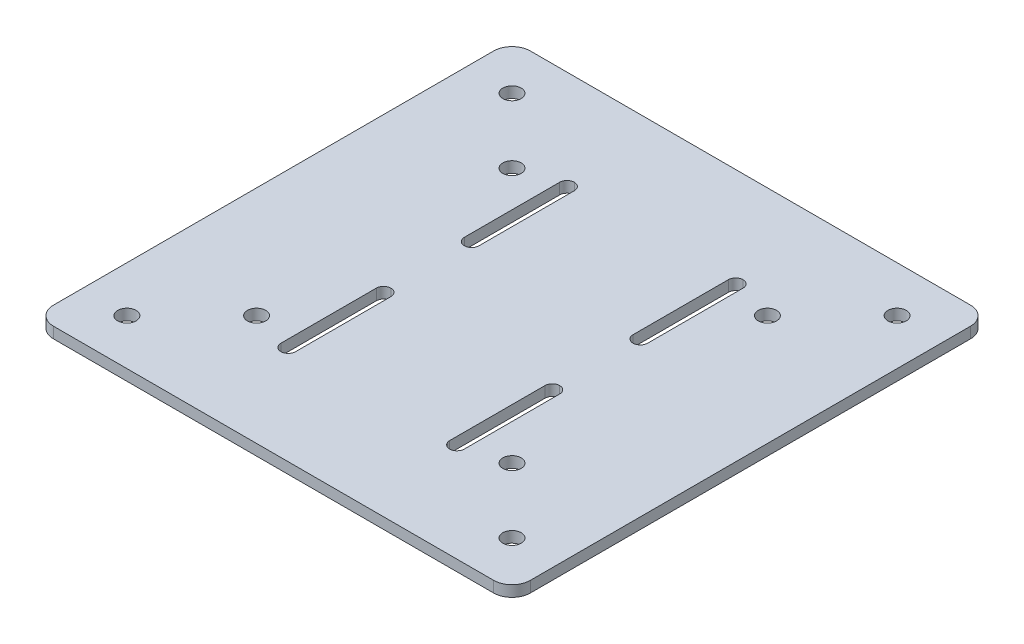
from build123d import *

# Parameters (mm, degrees)
SKETCH1_W           = 130
SKETCH1_H           = 130
SKETCH1_R           = 2.5
SKETCH1_W_2         = 4
SKETCH1_H_2         = 30
BOSS_EXTRUDE1_DEPTH = 3
FILLET1_R           = 5
FILLET2_R           = 2


with BuildPart() as part:
    # Sketch1 → Boss-Extrude1 (new body)
    with BuildSketch(Plane(origin=(0, 0, 0), x_dir=(1, 0, 0), z_dir=(0, 1, 0))):
        Rectangle(SKETCH1_W, SKETCH1_H)
        with Locations(Location((-52.5, 52.5, 0), (0, 0, 270))):
            Circle(SKETCH1_R, mode=Mode.SUBTRACT)
        with Locations(Location((-34.82233047, 34.82233047, 0), (0, 0, 270))):
            Circle(SKETCH1_R, mode=Mode.SUBTRACT)
        with Locations(Location((52.5, 52.5, 0), (0, 0, 270))):
            Circle(SKETCH1_R, mode=Mode.SUBTRACT)
        with Locations(Location((34.82233047, 34.82233047, 0), (0, 0, 270))):
            Circle(SKETCH1_R, mode=Mode.SUBTRACT)
        with Locations(Location((52.5, -52.5, 0), (0, 0, 90))):
            Circle(SKETCH1_R, mode=Mode.SUBTRACT)
        with Locations(Location((34.82233047, -34.82233047, 0), (0, 0, 90))):
            Circle(SKETCH1_R, mode=Mode.SUBTRACT)
        with Locations(Location((-34.82233047, -34.82233047, 0), (0, 0, 90))):
            Circle(SKETCH1_R, mode=Mode.SUBTRACT)
        with Locations(Location((-52.5, -52.5, 0), (0, 0, 90))):
            Circle(SKETCH1_R, mode=Mode.SUBTRACT)
        with Locations((-23, 25)):
            Rectangle(SKETCH1_W_2, SKETCH1_H_2, mode=Mode.SUBTRACT)
        with Locations((23, 25)):
            Rectangle(SKETCH1_W_2, SKETCH1_H_2, mode=Mode.SUBTRACT)
        with Locations((23, -25)):
            Rectangle(SKETCH1_W_2, SKETCH1_H_2, mode=Mode.SUBTRACT)
        with Locations((-23, -25)):
            Rectangle(SKETCH1_W_2, SKETCH1_H_2, mode=Mode.SUBTRACT)
    extrude(amount=BOSS_EXTRUDE1_DEPTH)

    # Fillet1
    fillet1_edges = [part.edges().sort_by_distance(p)[0] for p in [
        (65, 1.5, 65),
        (-65, 1.5, 65),
        (-65, 1.5, -65),
        (65, 1.5, -65),
    ]]
    fillet(fillet1_edges, radius=FILLET1_R)

    # Fillet2
    fillet2_edges = [part.edges().sort_by_distance(p)[0] for p in [
        (-25, 1.5, 40),
        (-21, 1.5, 40),
        (-25, 1.5, 10),
        (-21, 1.5, 10),
        (-21, 1.5, -10),
        (-25, 1.5, -10),
        (-25, 1.5, -40),
        (-21, 1.5, -40),
        (25, 1.5, -40),
        (21, 1.5, -40),
        (21, 1.5, -10),
        (25, 1.5, -10),
        (21, 1.5, 10),
        (25, 1.5, 10),
        (21, 1.5, 40),
        (25, 1.5, 40),
    ]]
    fillet(fillet2_edges, radius=FILLET2_R - 0.0001)  # a hair under: the kernel refuses the full size


solid = part.part
